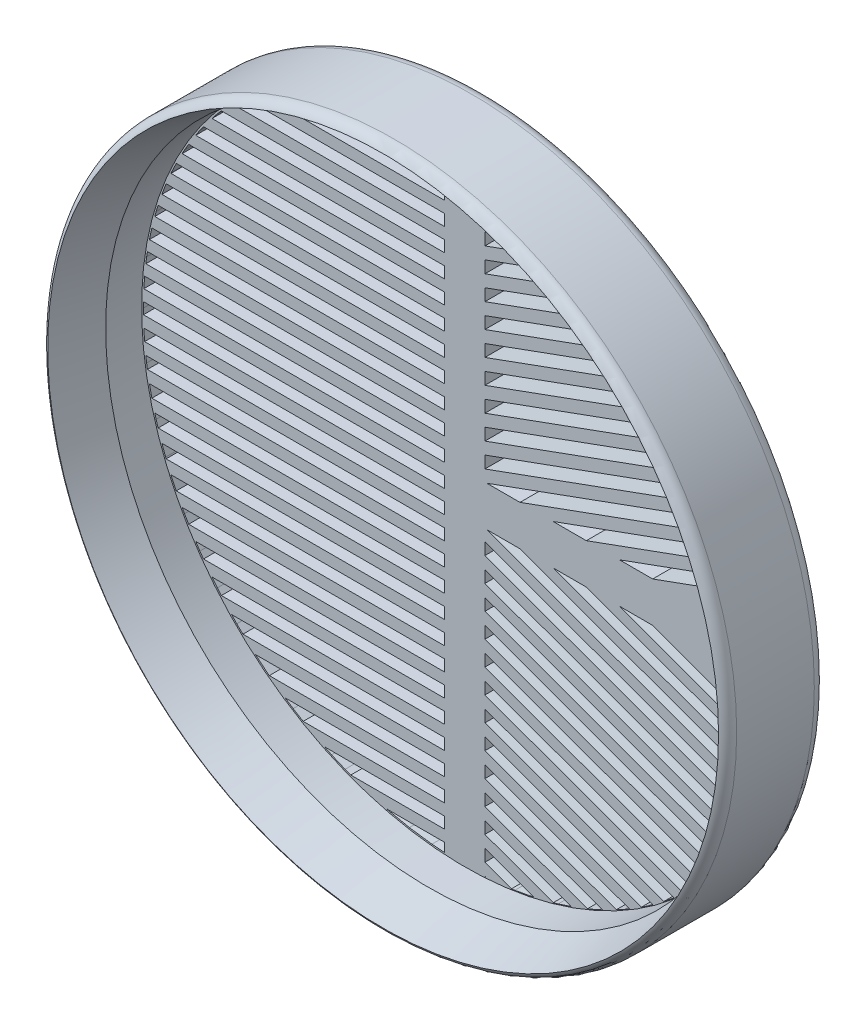
from build123d import *

# Parameters (mm, degrees)
BOSS_EXTRUDE1_DEPTH = 3
SKETCH2_R           = 53.25
SKETCH2_R_2         = 50.25
BOSS_EXTRUDE2_DEPTH = 12.7
SKETCH3_R           = 78.65
SKETCH3_R_2         = 53.25
CUT_EXTRUDE1_DEPTH  = 172.970310632
CHAMFER1_SIZE       = 1.905
CHAMFER1_SIZE2      = 7.109556788
FILLET1_R           = 1.905


with BuildPart() as part:
    # Model → Boss-Extrude1 (new body)
    with BuildSketch(Plane.XY):
        Polygon((72.377828047, 105.926652357), (75.5940723, 105.845327681), (78.768092601, 105.603971644), (81.895970154, 105.206511246), (84.973770014, 104.656873513), (87.99756262, 103.958985398), (90.963429175, 103.116773771), (93.867440118, 102.134165756), (96.705665885, 101.015088728), (99.474182298, 99.763468716), (102.169065179, 98.3832336), (107.322195943, 95.25262554), (112.133659363, 91.65467951), (116.572040473, 87.620811823), (120.605902778, 83.182438787), (124.203852844, 78.370975367), (127.334454176, 73.217836528), (128.714699385, 70.522959031), (129.966313341, 67.754442618), (131.085388014, 64.916214159), (132.068004608, 62.012205908), (132.910212029, 59.046336661), (133.608102247, 56.022544056), (134.157734934, 52.944744195), (134.55520206, 49.816866642), (134.796552531, 46.642846341), (134.877878316, 43.426602088), (134.796552531, 40.210357836), (134.55520206, 37.036337535), (134.157734934, 33.908459981), (133.608102247, 30.830660121), (132.910212029, 27.806867515), (132.068004608, 24.84100096), (131.085388014, 21.936990017), (129.966313341, 19.09876425), (128.714699385, 16.330247837), (127.334454176, 13.635364956), (124.203852844, 8.482234192), (120.605902778, 3.670770772), (116.572040473, -0.767610338), (112.133659363, -4.801472643), (107.322195943, -8.399422709), (102.169065179, -11.530024041), (99.474182298, -12.91026925), (96.705665885, -14.161883206), (93.867440118, -15.280957879), (90.963429175, -16.263574473), (87.99756262, -17.105781894), (84.973770014, -17.803672112), (81.895970154, -18.353304799), (78.768092601, -18.750771925), (75.5940723, -18.992122396), (72.377828047, -19.073448181), (69.161583794, -18.992122396), (65.987563494, -18.750771925), (62.85968594, -18.353304799), (59.78188608, -17.803672112), (56.758093474, -17.105781894), (53.792224227, -16.263574473), (50.888215976, -15.280957879), (48.049987517, -14.161883206), (45.281471104, -12.91026925), (42.586593607, -11.530024041), (37.433454768, -8.399422709), (32.621991348, -4.801472643), (28.183618312, -0.767610338), (24.149750625, 3.670770772), (20.551804596, 8.482234192), (17.421196535, 13.635364956), (16.040961419, 16.330247837), (14.789341407, 19.09876425), (13.670264379, 21.936990017), (12.687656364, 24.84100096), (11.845444738, 27.806867515), (11.147556622, 30.830660121), (10.597918889, 33.908459981), (10.200458492, 37.036337535), (9.959102454, 40.210357836), (9.877777778, 43.426602088), (9.959102454, 46.642846341), (10.200458492, 49.816866642), (10.597918889, 52.944744195), (11.147556622, 56.022544056), (11.845444738, 59.046336661), (12.687656364, 62.012205908), (13.670264379, 64.916214159), (14.789341407, 67.754442618), (16.040961419, 70.522959031), (17.421196535, 73.217836528), (20.551804596, 78.370975367), (24.149750625, 83.182438787), (28.183618312, 87.620811823), (32.621991348, 91.65467951), (37.433454768, 95.25262554), (42.586593607, 98.3832336), (45.281471104, 99.763468716), (48.049987517, 101.015088728), (50.888215976, 102.134165756), (53.792224227, 103.116773771), (56.758093474, 103.958985398), (59.78188608, 104.656873513), (62.85968594, 105.206511246), (65.987563494, 105.603971644), (69.161583794, 105.845327681), align=None)
        Polygon((75.502831099, -6.515181563), (75.502831099, -6.573435974), (75.632829624, -6.562497796), align=None, mode=Mode.SUBTRACT)
        Polygon((60.235572857, -5.080342356), (60.336767154, -5.107935418), (63.761224365, -5.829467604), (67.26745953, -6.312965224), (69.252824995, -6.464861637), (69.252824995, -5.080342356), align=None, mode=Mode.SUBTRACT)
        Polygon((75.502831099, -2.760996416), (75.502831099, -4.638088989), (79.634216521, -6.141787042), (80.169552061, -6.07151786), (82.451830928, -5.663403236), (83.083284632, -5.520065731), align=None, mode=Mode.SUBTRACT)
        Polygon((50.568185446, -1.552564579), (51.671073553, -2.086500549), (53.768108559, -2.985681237), (54.649474335, -3.316453467), (69.252824995, -3.316453467), (69.252824995, -1.552564579), align=None, mode=Mode.SUBTRACT)
        Polygon((75.502831099, 0.993188731), (75.502831099, -0.883903843), (86.139918688, -4.755491384), (86.901893065, -4.54517907), (88.915562142, -3.88865153), align=None, mode=Mode.SUBTRACT)
        Polygon((44.453149033, 1.975213199), (45.69371446, 1.150091298), (47.253527196, 0.21132431), (69.252824995, 0.21132431), (69.252824995, 1.975213199), align=None, mode=Mode.SUBTRACT)
        Polygon((75.502831099, 4.747363112), (75.502831099, 2.870270538), (91.439697478, -2.930269029), (93.253739421, -2.149901072), (93.767925305, -1.900583818), align=None, mode=Mode.SUBTRACT)
        Polygon((39.829777061, 5.502990977), (40.241280259, 5.140932973), (41.986237272, 3.739102088), (69.252824995, 3.739102088), (69.252824995, 5.502990977), align=None, mode=Mode.SUBTRACT)
        Polygon((75.502831099, 8.501548258), (75.502831099, 6.624455685), (95.935084152, -0.812278154), (97.24402665, -0.103191376), (97.960601128, 0.327596283), align=None, mode=Mode.SUBTRACT)
        Polygon((36.129836019, 9.030768755), (36.932422151, 8.186052873), (37.887437609, 7.266879866), (69.252824995, 7.266879866), (69.252824995, 9.030768755), align=None, mode=Mode.SUBTRACT)
        Polygon((75.502831099, 12.255733405), (75.502831099, 10.378640832), (99.860065291, 1.513333554), (101.015862528, 2.280384064), (101.64616428, 2.740336609), align=None, mode=Mode.SUBTRACT)
        Polygon((33.080985726, 12.558546533), (33.908570332, 11.514650302), (34.533844397, 10.794657644), (69.252824995, 10.794657644), (69.252824995, 12.558546533), align=None, mode=Mode.SUBTRACT)
        Polygon((75.502831099, 16.009913169), (75.502831099, 14.132825979), (103.329287211, 4.004826609), (104.549529266, 4.981080543), (104.918014526, 5.303659905), align=None, mode=Mode.SUBTRACT)
        Polygon((30.547563436, 16.08632431), (31.190414217, 15.106043922), (31.756307485, 14.322435421), (69.252824995, 14.322435421), (69.252824995, 16.08632431), align=None, mode=Mode.SUBTRACT)
        Polygon((28.438942952, 19.614102088), (28.798637835, 18.939547009), (29.44460535, 17.850213199), (69.252824995, 17.850213199), (69.252824995, 19.614102088), align=None, mode=Mode.SUBTRACT)
        Polygon((75.502831099, 19.764098316), (75.502831099, 17.887005742), (106.419527096, 6.634252675), (107.825266012, 7.979164124), (107.839832306, 7.994387139), align=None, mode=Mode.SUBTRACT)
        Polygon((26.691859669, 23.141879866), (26.75392118, 22.994456694), (27.523404789, 21.377990977), (69.252824995, 21.377990977), (69.252824995, 23.141879866), align=None, mode=Mode.SUBTRACT)
        Polygon((75.502831099, 23.51827808), (75.502831099, 21.641190889), (109.17186771, 9.38666865), (109.360249837, 9.583566623), (110.430167304, 10.805768077), align=None, mode=Mode.SUBTRACT)
        Polygon((25.290392134, 26.669657644), (25.868175019, 25.098473401), (25.949300289, 24.905768755), (69.252824995, 24.905768755), (69.252824995, 26.669657644), align=None, mode=Mode.SUBTRACT)
        Polygon((75.502831099, 27.272463226), (75.502831099, 25.395370653), (111.619468096, 12.249984402), (112.212099881, 12.990722995), (112.742946031, 13.718165673), align=None, mode=Mode.SUBTRACT)
        Polygon((24.183527364, 30.197435421), (24.382835558, 29.446689902), (24.702983167, 28.433546533), (69.252824995, 28.433546533), (69.252824995, 30.197435421), align=None, mode=Mode.SUBTRACT)
        Polygon((75.502831099, 31.02664299), (75.502831099, 29.1495558), (113.803281826, 15.209321425), (114.756701236, 16.645942391), (114.80280092, 16.722628064), align=None, mode=Mode.SUBTRACT)
        Polygon((23.347963863, 33.725213199), (23.72889453, 31.96132431), (69.252824995, 31.96132431), (69.252824995, 33.725213199), align=None, mode=Mode.SUBTRACT)
        Polygon((75.502831099, 34.780828137), (75.502831099, 32.903740946), (115.728670332, 18.262731086), (115.907621511, 18.560403485), (116.592840237, 19.825286441), align=None, mode=Mode.SUBTRACT)
        Polygon((22.793251006, 37.252990977), (22.908991411, 36.280688137), (23.041353056, 35.489102088), (69.252824995, 35.489102088), (69.252824995, 37.252990977), align=None, mode=Mode.SUBTRACT)
        Polygon((75.502831099, 38.535013284), (75.502831099, 36.65792071), (117.400478278, 21.408420859), (117.954331207, 22.550690715), (118.152661048, 23.011741384), align=None, mode=Mode.SUBTRACT)
        Polygon((96.435495038, 40.301599036), (121.014501868, 31.355574248), (121.408093262, 33.089410061), (101.592765299, 40.301599036), align=None, mode=Mode.SUBTRACT)
        Polygon((86.120959897, 40.301599036), (120.040917884, 27.955744086), (120.349609205, 28.90253707), (120.554753876, 29.645816422), (91.278235541, 40.301599036), align=None, mode=Mode.SUBTRACT)
        Polygon((75.806430138, 40.301599036), (118.850228288, 24.634935803), (119.473004659, 26.285357242), (80.963705783, 40.301599036), align=None, mode=Mode.SUBTRACT)
        Polygon((22.476007504, 40.780768755), (22.601698314, 39.016879866), (69.252824995, 39.016879866), (69.252824995, 40.780768755), align=None, mode=Mode.SUBTRACT)
        Polygon((22.423099719, 44.308546533), (22.402197679, 43.426602088), (22.423099719, 42.544657644), (69.252824995, 42.544657644), (69.252824995, 44.308546533), align=None, mode=Mode.SUBTRACT)
        Polygon((22.601698314, 47.83632431), (22.476007504, 46.072435421), (69.252824995, 46.072435421), (69.252824995, 47.83632431), align=None, mode=Mode.SUBTRACT)
        Polygon((23.041353056, 51.364102088), (22.908991411, 50.572516039), (22.793251006, 49.600213199), (69.252824995, 49.600213199), (69.252824995, 51.364102088), align=None, mode=Mode.SUBTRACT)
        Polygon((23.72889453, 54.891879866), (23.347965209, 53.127990977), (69.252824995, 53.127990977), (69.252824995, 54.891879866), align=None, mode=Mode.SUBTRACT)
        Polygon((121.014501868, 55.497635312), (96.43550042, 46.55160514), (101.592776065, 46.55160514), (121.408093262, 53.763794115), align=None, mode=Mode.SUBTRACT)
        Polygon((24.702984513, 58.419657644), (24.382835558, 57.406508891), (24.183527364, 56.655768755), (69.252824995, 56.655768755), (69.252824995, 58.419657644), align=None, mode=Mode.SUBTRACT)
        Polygon((120.040917884, 58.89746009), (86.120959897, 46.55160514), (91.278235541, 46.55160514), (120.554753876, 57.207387755), (120.349609205, 57.950672489), align=None, mode=Mode.SUBTRACT)
        Polygon((25.949301635, 61.947435421), (25.868175019, 61.754728084), (25.290394825, 60.183546533), (69.252824995, 60.183546533), (69.252824995, 61.947435421), align=None, mode=Mode.SUBTRACT)
        Polygon((118.850228288, 62.218268373), (75.806430138, 46.55160514), (80.9637004, 46.55160514), (119.473004659, 60.567846934), align=None, mode=Mode.SUBTRACT)
        Polygon((117.400489044, 65.444783317), (75.502831099, 50.195283466), (75.502831099, 48.318190893), (118.152661048, 63.841462792), (117.954331207, 64.302516153), align=None, mode=Mode.SUBTRACT)
        Polygon((27.523404789, 65.475213199), (26.75392118, 63.858742099), (26.691861015, 63.71132431), (69.252824995, 63.71132431), (69.252824995, 65.475213199), align=None, mode=Mode.SUBTRACT)
        Polygon((115.728670332, 68.590475782), (75.502831099, 53.949468613), (75.502831099, 52.072376039), (116.592840237, 67.027917735), (115.907621511, 68.292803383), align=None, mode=Mode.SUBTRACT)
        Polygon((29.444606696, 69.002990977), (28.798637835, 67.913651784), (28.438945643, 67.239102088), (69.252824995, 67.239102088), (69.252824995, 69.002990977), align=None, mode=Mode.SUBTRACT)
        Polygon((113.803292592, 71.643874677), (75.502831099, 57.703648376), (75.502831099, 55.826555803), (114.80280092, 70.130578804), (114.756701236, 70.207261785), align=None, mode=Mode.SUBTRACT)
        Polygon((31.756312868, 72.530768755), (31.190414217, 71.74715218), (30.547566128, 70.766879866), (69.252824995, 70.766879866), (69.252824995, 72.530768755), align=None, mode=Mode.SUBTRACT)
        Polygon((111.619468096, 74.603214391), (75.502831099, 61.457830832), (75.502831099, 59.58074095), (112.742946031, 73.13503312), (112.212099881, 73.862475798), align=None, mode=Mode.SUBTRACT)
        Polygon((34.533847088, 76.058546533), (33.908570332, 75.338551182), (33.080988418, 74.294657644), (69.252824995, 74.294657644), (69.252824995, 76.058546533), align=None, mode=Mode.SUBTRACT)
        Polygon((109.17186771, 77.4665436), (75.502831099, 65.212015978), (75.502831099, 63.334923405), (110.430167304, 76.0474361), (109.360249837, 77.269642936), align=None, mode=Mode.SUBTRACT)
        Polygon((37.8874403, 79.58632431), (36.932422151, 78.667153994), (36.12983871, 77.822435421), (69.252824995, 77.822435421), (69.252824995, 79.58632431), align=None, mode=Mode.SUBTRACT)
        Polygon((106.419527096, 80.218956884), (75.502831099, 68.966198434), (75.502831099, 67.089108552), (107.839832306, 78.858814345), (107.825266012, 78.874040053), align=None, mode=Mode.SUBTRACT)
        Polygon((103.329287211, 82.848380258), (75.502831099, 72.720378198), (75.502831099, 70.843291007), (104.918014526, 81.549541579), (104.549529266, 81.872123633), align=None, mode=Mode.SUBTRACT)
        Polygon((41.986239963, 83.114102088), (40.241280259, 81.712263128), (39.829779752, 81.350213199), (69.252824995, 81.350213199), (69.252824995, 83.114102088), align=None, mode=Mode.SUBTRACT)
        Polygon((99.860065291, 85.339871968), (75.502831099, 76.474563344), (75.502831099, 74.597473462), (101.64616428, 84.112870259), (101.015862528, 84.572818767), align=None, mode=Mode.SUBTRACT)
        Polygon((47.253529888, 86.64187852), (45.69371446, 85.703112878), (44.453149033, 84.877989631), (69.252824995, 84.877989631), (69.252824995, 86.64187852), align=None, mode=Mode.SUBTRACT)
        Polygon((95.935084152, 87.665478293), (75.502831099, 80.2287458), (75.502831099, 78.351653226), (97.960595746, 86.52561193), (97.24402665, 86.956390169), align=None, mode=Mode.SUBTRACT)
        Polygon((91.439697478, 89.783473206), (75.502831099, 83.982928255), (75.502831099, 82.105835681), (93.767930688, 88.75378934), (93.253739421, 89.003101211), align=None, mode=Mode.SUBTRACT)
        Polygon((54.649474335, 90.169656298), (53.768108559, 89.83888003), (51.671073553, 88.939702034), (50.568185446, 88.405767409), (69.252824995, 88.405767409), (69.252824995, 90.169656298), align=None, mode=Mode.SUBTRACT)
        Polygon((86.139913305, 91.608692869), (75.502831099, 87.737112056), (75.502831099, 85.860020828), (88.915562142, 90.741855706), (86.901893065, 91.398384592), align=None, mode=Mode.SUBTRACT)
        Polygon((79.634221903, 92.994995255), (75.502831099, 91.491293165), (75.502831099, 89.614201938), (83.083290015, 92.373264525), (82.451830928, 92.516606066), (80.169552061, 92.924723381), align=None, mode=Mode.SUBTRACT)
        Polygon((69.252824995, 93.318065813), (67.26745953, 93.166170745), (63.761224365, 92.682674472), (60.336767154, 91.96114094), (60.235567474, 91.933545187), (69.252824995, 91.933545187), align=None, mode=Mode.SUBTRACT)
        Polygon((75.502831099, 93.426641496), (75.502831099, 93.368384393), (75.632829624, 93.415700626), align=None, mode=Mode.SUBTRACT)
    extrude(amount=BOSS_EXTRUDE1_DEPTH)

    # Sketch2 → Boss-Extrude2 (add)
    with BuildSketch(Plane.XY.offset(3)):
        with Locations((72.377828047, 43.426602088)):
            Circle(SKETCH2_R)
        with Locations((72.377828047, 43.426602088)):
            Circle(SKETCH2_R_2, mode=Mode.SUBTRACT)
    extrude(amount=BOSS_EXTRUDE2_DEPTH)

    # Sketch3 → Cut-Extrude1 (cut, through all)
    with BuildSketch(Plane.XY.offset(3)):
        with Locations((72.377828047, 43.426602088)):
            Circle(SKETCH3_R)
        with Locations((72.377828047, 43.426602088)):
            Circle(SKETCH3_R_2, mode=Mode.SUBTRACT)
    extrude(amount=-CUT_EXTRUDE1_DEPTH, mode=Mode.SUBTRACT)

    # Chamfer1
    chamfer1_edges = [part.edges().sort_by_distance(p)[0] for p in [
        (22.127828047, 43.426602088, 15.7),
    ]]
    chamfer1_side = [part.faces().sort_by_distance(p)[0] for p in [
        (20.633965491, 43.426602088, 15.7),
    ]]
    chamfer(chamfer1_edges, length=CHAMFER1_SIZE, length2=CHAMFER1_SIZE2, reference=chamfer1_side[0])

    # Fillet1
    # the kernel refuses this fillet: 1.905 mm, written as the material it takes off along each edge
    with BuildSketch(Plane(origin=(72.377828047, 43.426602088, 15.7), x_dir=(1, 0, 0), z_dir=(0, -1, 0))) as fillet1_piece_1:
        with BuildLine():
            CenterArc((51.345, -1.724217214), FILLET1_R, 0, 64.836875965)
            Line((53.25, -1.724217214), (53.2881, -1.724217214))
            Line((53.2881, -1.724217214), (53.2881, 0))
            Line((53.2881, 0), (53.25, 0.0381))
            ThreePointArc((53.25, 0.0381), (52.7025, 0.0381), (52.1712, 0.034484344))
            Line((52.1712, 0.034484344), (52.155, 0))
        make_face()
    revolve(axis=Axis((72.377828047, 43.426602088, 15.7), (0, 0, 1)), mode=Mode.SUBTRACT)
    with BuildSketch(Plane(origin=(72.377828047, 43.426602088, 0), x_dir=(1, 0, 0), z_dir=(0, -1, 0))) as fillet1_piece_2:
        with BuildLine():
            CenterArc((53.25 - FILLET1_R, FILLET1_R), FILLET1_R, 270, 90)
            Line((53.25 - FILLET1_R, 0), (53.25 - FILLET1_R, -FILLET1_R * 0.02))
            Line((53.25 - FILLET1_R, -FILLET1_R * 0.02), (53.25 + FILLET1_R * 0.02, -FILLET1_R * 0.02))
            Line((53.25 + FILLET1_R * 0.02, -FILLET1_R * 0.02), (53.25 + FILLET1_R * 0.02, FILLET1_R))
            Line((53.25 + FILLET1_R * 0.02, FILLET1_R), (53.25, FILLET1_R))
        make_face()
    revolve(axis=Axis((72.377828047, 43.426602088, 0), (0, 0, 1)), mode=Mode.SUBTRACT)


solid = part.part
